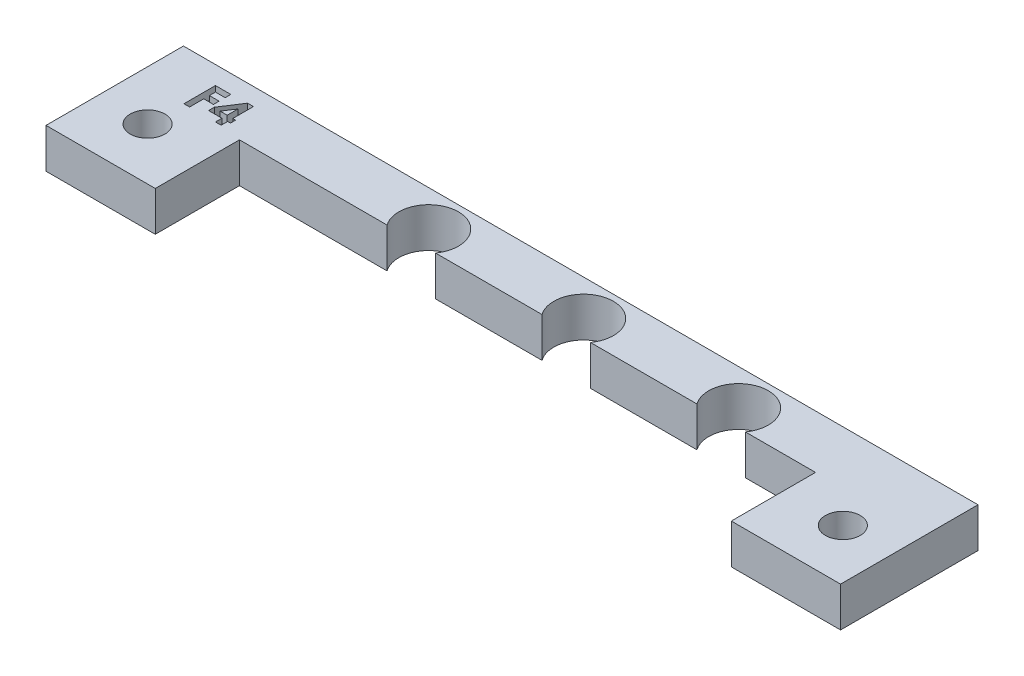
from build123d import *

# Parameters (mm, degrees)
BOSS_EXTRUDE1_OUTLINE_R = 1.75
BOSS_EXTRUDE1_DEPTH     = 4
CUT_EXTRUDE1_DEPTH      = 1


# Read off the part's stored shape, not the designer's step: Boss-Extrude1
with BuildPart() as part:
    # Boss-Extrude1 outline → Boss-Extrude1 (new body)
    with BuildSketch(Plane(origin=(0, 0, 0), x_dir=(1, 0, 0), z_dir=(0, 1, 0))):
        with BuildLine():
            Line((24.866474615, -10.33744254), (35.59307775, -10.33744254))
            ThreePointArc((35.59307775, -10.33744254), (38.029776183, -5.587442326), (40.466474615, -10.33744254))
            Line((40.466474615, -10.33744254), (47.529776182, -10.33744254))
            Line((47.529776182, -10.33744254), (47.529776182, -18.81631662))
            Line((47.529776182, -18.81631662), (58.529776182, -18.81631662))
            Line((58.529776182, -18.81631662), (58.529776182, -4.977921711))
            Line((58.529776182, -4.977921711), (-21.470223818, -4.977921711))
            Line((-21.470223818, -4.977921711), (-21.470223818, -18.81631662))
            Line((-21.470223818, -18.81631662), (-10.470223818, -18.81631662))
            Line((-10.470223818, -18.81631662), (-10.470223818, -10.33744254))
            Line((-10.470223818, -10.33744254), (4.39307775, -10.33744254))
            ThreePointArc((4.39307775, -10.33744254), (6.829776182, -5.587442326), (9.266474615, -10.33744254))
            Line((9.266474615, -10.33744254), (19.99307775, -10.33744254))
            ThreePointArc((19.99307775, -10.33744254), (22.429776182, -5.587442326), (24.866474615, -10.33744254))
        make_face()
        with Locations((-16.470223818, -13.587442433)):
            Circle(BOSS_EXTRUDE1_OUTLINE_R, mode=Mode.SUBTRACT)
        with Locations((53.529776182, -13.587442433)):
            Circle(BOSS_EXTRUDE1_OUTLINE_R, mode=Mode.SUBTRACT)
    extrude(amount=BOSS_EXTRUDE1_DEPTH)

    # Sketch2 → Cut-Extrude1 (cut)
    # profile 1 of 2: a face of its own
    with BuildSketch(Plane(origin=(0, 4, 0), x_dir=(1, 0, 0), z_dir=(0, 1, 0))):
        Polygon((-16.41198232, -6.812466594), (-14.865187448, -6.812466594), (-14.865187448, -7.382338389), (-15.842110525, -7.382338389), (-15.842110525, -7.992915312), (-14.865187448, -7.992915312), (-14.865187448, -8.562787107), (-15.842110525, -8.562787107), (-15.842110525, -9.987466594), (-16.41198232, -9.987466594), align=None)
    # profile 2 of 2: a face of its own
    with BuildSketch(Plane(origin=(0, 4, 0), x_dir=(1, 0, 0), z_dir=(0, 1, 0))):
        Polygon((-13.260514973, -6.731056337), (-12.667110525, -6.731056337), (-12.667110525, -8.807017876), (-12.382174628, -8.807017876), (-12.382174628, -9.336184543), (-12.667110525, -9.336184543), (-12.667110525, -9.987466594), (-13.23698232, -9.987466594), (-13.23698232, -9.336184543), (-14.580251551, -9.336184543), (-14.580251551, -8.759316554), align=None)
        Polygon((-13.23698232, -8.807017876), (-13.23698232, -7.726423926), (-13.939781799, -8.807017876), align=None, mode=Mode.SUBTRACT)
    extrude(amount=-CUT_EXTRUDE1_DEPTH, mode=Mode.SUBTRACT)


solid = part.part
